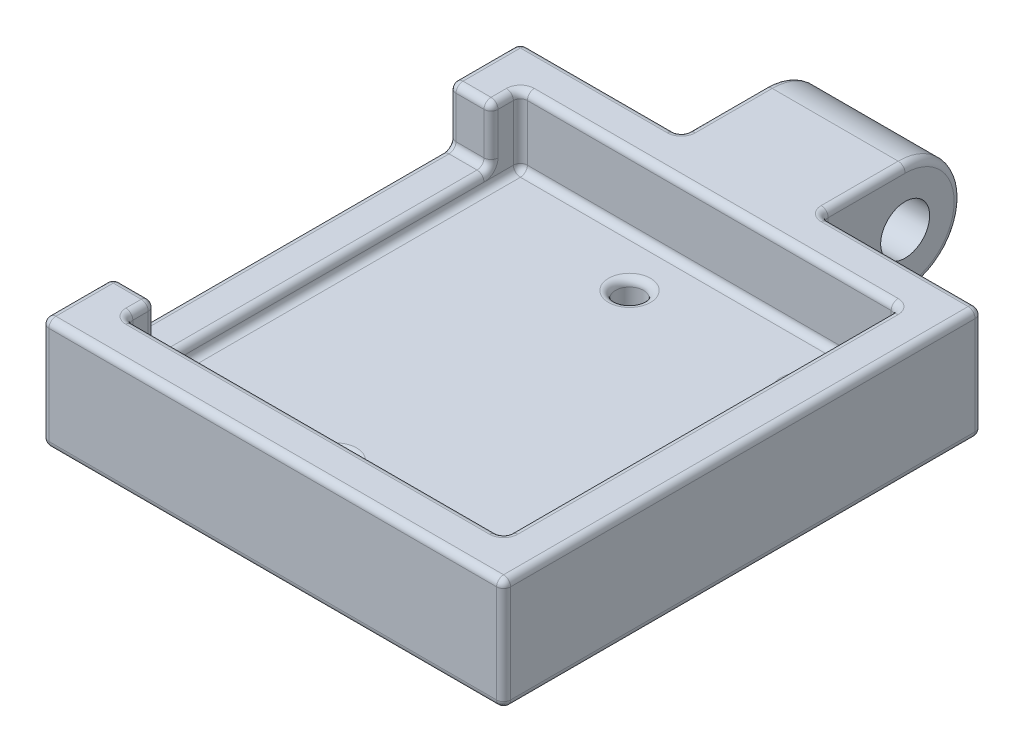
from build123d import *

# Parameters (mm, degrees)
SKETCH1_W           = 33
SKETCH1_H           = 34.2
SKETCH1_W_2         = 27
SKETCH1_H_2         = 28.2
BOSS_EXTRUDE1_DEPTH = 5
SKETCH2_W           = 33
SKETCH2_H           = 34.2
BOSS_EXTRUDE2_DEPTH = 3
SKETCH3_R           = 1
CUT_EXTRUDE1_DEPTH  = 25.282915805
SKETCH4_W           = 3
SKETCH4_H           = 24
CUT_EXTRUDE2_DEPTH  = 4
SKETCH5_R           = 1.75
BOSS_EXTRUDE3_DEPTH = 5
FILLET1_R           = 0.5


with BuildPart() as part:
    # Sketch1 → Boss-Extrude1 (new body)
    with BuildSketch(Plane(origin=(0, 0, 0), x_dir=(1, 0, 0), z_dir=(0, 1, 0))):
        Rectangle(SKETCH1_W, SKETCH1_H)
        Rectangle(SKETCH1_W_2, SKETCH1_H_2, mode=Mode.SUBTRACT)
    extrude(amount=BOSS_EXTRUDE1_DEPTH)

    # Sketch2 → Boss-Extrude2 (add)
    with BuildSketch(Plane.XZ):
        Rectangle(SKETCH2_W, SKETCH2_H)
    extrude(amount=BOSS_EXTRUDE2_DEPTH)

    # Sketch3 → Cut-Extrude1 (cut, through all)
    with BuildSketch(Plane(origin=(0, 0, 0), x_dir=(1, 0, 0), z_dir=(0, 1, 0))):
        with Locations(Location((-2.1, 10.5, 0), (0, 0, 270))):
            Circle(SKETCH3_R)
        with Locations(Location((10.2, 10.5, 0), (0, 0, 270))):
            Circle(SKETCH3_R)
        with Locations(Location((10.2, -10.5, 0), (0, 0, 270))):
            Circle(SKETCH3_R)
        with Locations(Location((-2.1, -10.5, 0), (0, 0, 270))):
            Circle(SKETCH3_R)
    extrude(amount=-CUT_EXTRUDE1_DEPTH, mode=Mode.SUBTRACT)

    # Sketch4 → Cut-Extrude2 (cut)
    with BuildSketch(Plane(origin=(0, 5, 0), x_dir=(1, 0, 0), z_dir=(0, 1, 0))):
        with Locations((-15, 0)):
            Rectangle(SKETCH4_W, SKETCH4_H)
    extrude(amount=-CUT_EXTRUDE2_DEPTH, mode=Mode.SUBTRACT)

    # Sketch5 → Boss-Extrude3 (add, symmetric)
    with BuildSketch(Plane(origin=(0, 0, 0), x_dir=(0, 0, -1), z_dir=(1, 0, 0))):
        with BuildLine():
            Line((17.1, 5), (23.1, 5))
            ThreePointArc((23.1, 5), (27.1, 1), (23.1, -3))
            Line((23.1, -3), (17.1, -3))
            Line((17.1, -3), (17.1, 5))
        make_face()
        with Locations((23.1, 1)):
            Circle(SKETCH5_R, mode=Mode.SUBTRACT)
    extrude(amount=BOSS_EXTRUDE3_DEPTH, both=True)

    # Fillet1
    fillet1_edges = [part.edges().sort_by_distance(p)[0] for p in [
        (10.75, 5, -17.1),
        (13.5, 0, 0),
        (13.5, 2.5, 14.1),
        (0, 0, -14.1),
        (13.5, 2.5, -14.1),
        (-13.5, 0, 0),
        (-13.5, 2.5, -14.1),
        (0, 0, 14.1),
        (-13.5, 2.5, 14.1),
        (13.5, 5, 0),
        (-16.5, 5, -14.55),
        (0, 5, -14.1),
        (-13.5, 5, -13.05),
        (0, 5, 14.1),
        (16.5, -3, 0),
        (0, -3, 17.1),
        (-16.5, -3, 0),
        (-10.75, -3, -17.1),
        (0, 5, 17.1),
        (-2.1, -3, 9.5),
        (-2.1, 0, 9.5),
        (10.2, -3, 9.5),
        (10.2, 0, 9.5),
        (10.2, -3, -11.5),
        (10.2, 0, -11.5),
        (-2.1, -3, -11.5),
        (-2.1, 0, -11.5),
        (-13.5, 5, 13.05),
        (-16.5, 5, 14.55),
        (-13.5, 3, -12),
        (-13.5, 3, 12),
        (-16.5, 3, 12),
        (-16.5, 3, -12),
        (-15, 5, -12),
        (-15, 5, 12),
        (-13.5, 1, 0),
        (-15, 1, 12),
        (-16.5, 1, 0),
        (-15, 1, -12),
        (-16.5, 1, 17.1),
        (10.75, -3, -17.1),
        (-16.5, 1, -17.1),
        (-10.75, 5, -17.1),
        (16.5, 1, -17.1),
        (5, 1, -17.1),
        (16.5, 1, 17.1),
        (5, -3, -20.1),
        (5, 1, -27.1),
        (5, 5, -20.1),
        (-5, 1, -17.1),
        (-5, -3, -20.1),
        (-5, 1, -27.1),
        (-5, 5, -20.1),
        (16.5, 5, 0),
    ]]
    fillet(fillet1_edges, radius=FILLET1_R - 0.0001)  # a hair under: the kernel refuses the full size


solid = part.part
